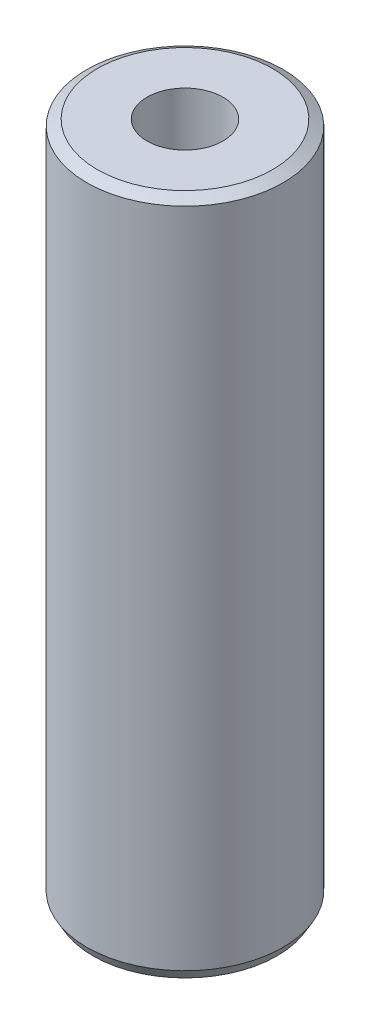
from build123d import *
from OCP.BRepFilletAPI import BRepFilletAPI_MakeChamfer

# Parameters (mm, degrees)
SKETCH1_R           = 40
BOSS_EXTRUDE1_DEPTH = 276.613206114
SKETCH2_R           = 15.493790066
CUT_EXTRUDE1_DEPTH  = 283.338211719
CHAMFER1_SIZE       = 2.479152558
CHAMFER1_SIZE2      = 4.29401819


with BuildPart() as part:
    # Sketch1 → Boss-Extrude1 (new body)
    with BuildSketch(Plane(origin=(0, 0, 0), x_dir=(1, 0, 0), z_dir=(0, 1, 0))):
        Circle(SKETCH1_R)
    extrude(amount=BOSS_EXTRUDE1_DEPTH)

    # Sketch2 → Cut-Extrude1 (cut, through all)
    with BuildSketch(Plane(origin=(0, 0, 0), x_dir=(1, 0, 0), z_dir=(0, 1, 0))):
        Circle(SKETCH2_R)
    extrude(amount=CUT_EXTRUDE1_DEPTH, mode=Mode.SUBTRACT)

    # Chamfer1: one chamfer whose edges measure the first distance from different faces: ONE call of the kernel's chamfer builder (chamfer() names one face for all edges)
    chamfer1_edges_1 = [part.edges().sort_by_distance(p)[0] for p in [
        (-40, 276.613206114, 0),
    ]]
    chamfer1_side_1 = [part.faces().sort_by_distance(p)[0] for p in [
        (-40, 138.306603057, 0),
    ]]
    chamfer1_edges_2 = [part.edges().sort_by_distance(p)[0] for p in [
        (-40, 0, 0),
    ]]
    chamfer1_side_2 = [part.faces().sort_by_distance(p)[0] for p in [
        (-38.86862915, 0, 0),
    ]]
    chamfer1 = BRepFilletAPI_MakeChamfer(part.part.solid().wrapped)
    for e in chamfer1_edges_1:
        chamfer1.Add(CHAMFER1_SIZE, CHAMFER1_SIZE2, e.wrapped, chamfer1_side_1[0].wrapped)  # the first distance lies on this face
    for e in chamfer1_edges_2:
        chamfer1.Add(CHAMFER1_SIZE, CHAMFER1_SIZE2, e.wrapped, chamfer1_side_2[0].wrapped)  # the first distance lies on this face
    add(Compound.cast(chamfer1.Shape()), mode=Mode.REPLACE)


solid = part.part
